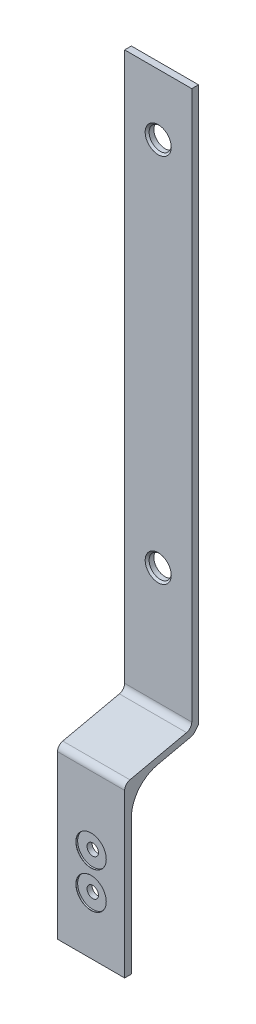
from build123d import *

# Parameters (mm, degrees)
ESTRUSIONE_SOTTILE1_DEPTH                    = 10
SCHIZZO4_W                                   = 20
SCHIZZO4_H                                   = 50
ESTRUSIONE_ESTRUSIONE1_DEPTH                 = 2
SCHIZZO1_W                                   = 20
SCHIZZO1_H                                   = 165
ESTRUSIONE_ESTRUSIONE2_DEPTH                 = 2
RACCORDO2_R                                  = 10
RACCORDO8_R                                  = 2
LOFT3_START                                  = -1.559581264
LOFT3_OUTLINE_W                              = 20
LOFT3_OUTLINE_H                              = 2.50416156
LOFT3_DEPTH                                  = 1.559581264
RACCORDO13_R                                 = 2
RACCORDO14_R                                 = 2
FORO_FILETTATO_G1_16_2_AT_2_COUNT            = 2
FORO_FILETTATO_G1_16_2_AT_2_PITCH            = 110.419904734
FORO_LAMATO_PER_BULLONE_M3_A_TESTA_E_2_COUNT = 2
FORO_LAMATO_PER_BULLONE_M3_A_TESTA_E_2_PITCH = 10.95


with BuildPart() as part:
    # Schizzo5 → Estrusione-Sottile1 (new, symmetric)
    with BuildSketch(Plane(origin=(0, 0, 0), x_dir=(0, 0, -1), z_dir=(1, 0, 0))):
        Polygon((-20, -4.427601882), (0, 0), (0.43229372, -1.952721726), (-19.56770628, -6.380323609), align=None)
    extrude(amount=ESTRUSIONE_SOTTILE1_DEPTH, both=True)

    # Schizzo4 → Estrusione-Estrusione1 (add)
    with BuildSketch(Plane.XY.offset(20)):
        with Locations((0, -29.427601882)):
            Rectangle(SCHIZZO4_W, SCHIZZO4_H)
    extrude(amount=-ESTRUSIONE_ESTRUSIONE1_DEPTH)

    # Raccordo2
    raccordo2_edges = [part.edges().sort_by_distance(p)[0] for p in [
        (0, -6.033264645, 18),
    ]]
    fillet(raccordo2_edges, radius=RACCORDO2_R)

    # Raccordo8
    raccordo8_edges = [part.edges().sort_by_distance(p)[0] for p in [
        (0, -4.427601882, 20),
    ]]
    fillet(raccordo8_edges, radius=RACCORDO8_R)



with BuildPart() as body_2:
    # Schizzo1 → Estrusione-Estrusione2 (new body)
    with BuildSketch(Plane.XY):
        with Locations((0, 82.5)):
            Rectangle(SCHIZZO1_W, SCHIZZO1_H)
    extrude(amount=-ESTRUSIONE_ESTRUSIONE2_DEPTH)


with BuildPart() as part_1:
    add(part.part)

    add(body_2.part)  # Loft3 merges body 2
    # Loft3: read off the stored shape, not the designer's step
    # Loft3 outline → Loft3 (add)
    with BuildSketch(Plane(origin=(0, 0, 0), x_dir=(1, 0, 0), z_dir=(0, 0.626040390160855, 0.779790632084821)).offset(LOFT3_START)):
        Rectangle(LOFT3_OUTLINE_W, LOFT3_OUTLINE_H)
    extrude(amount=LOFT3_DEPTH)

    # Raccordo13
    raccordo13_edges = [part_1.edges().sort_by_distance(p)[0] for p in [
        (0, -1.952721726, -0.43229372),
    ]]
    fillet(raccordo13_edges, radius=RACCORDO13_R)

    # Raccordo14
    raccordo14_edges = [part_1.edges().sort_by_distance(p)[0] for p in [
        (0, 0, 0),
    ]]
    fillet(raccordo14_edges, radius=RACCORDO14_R)

    # Schizzo11 → Foro filettato G1/16-2 (revolve, cut)
    with BuildSketch(Plane(origin=(0, 146.829705844, 0), x_dir=(0, -1, 0), z_dir=(1, 0, 0))):
        Polygon((0, 0), (0, 2.005), (3.3, 2.005), (3.3, 0.5865), (3.8865, 0), align=None)
    foro_filettato_g1_16_2 = revolve(axis=Axis((0, 146.829705844, 6.35), (0, 0, -1)), mode=Mode.SUBTRACT)

    # Foro filettato G1/16-2 at 2: Foro filettato G1/16-2 ×2
    with Locations(*[(0, -i * FORO_FILETTATO_G1_16_2_AT_2_PITCH, 0) for i in range(1, FORO_FILETTATO_G1_16_2_AT_2_COUNT)]):
        add(foro_filettato_g1_16_2, mode=Mode.SUBTRACT)

    # Schizzo27 → Foro lamato per Bullone M3 a testa esagonale-4 (revolve, cut)
    with BuildSketch(Plane(origin=(0, -26.530198891, 20), x_dir=(0, -1, 0), z_dir=(1, 0, 0))):
        Polygon((0, 0), (0, 22.005), (1.7, 22.005), (1.7, 0.5), (4.5, 0.5), (4.5, 0.025), (4.525, 0), align=None)
    foro_lamato_per_bullone_m3_a_testa_esago = revolve(axis=Axis((0, -26.530198891, 26.35), (0, 0, -1)), mode=Mode.SUBTRACT)

    # Foro lamato per Bullone M3 a testa e 2: Foro lamato per Bullone M3 a testa esagonale-4 ×2
    with Locations(*[(0, -i * FORO_LAMATO_PER_BULLONE_M3_A_TESTA_E_2_PITCH, 0) for i in range(1, FORO_LAMATO_PER_BULLONE_M3_A_TESTA_E_2_COUNT)]):
        add(foro_lamato_per_bullone_m3_a_testa_esago, mode=Mode.SUBTRACT)


solid = part_1.part
